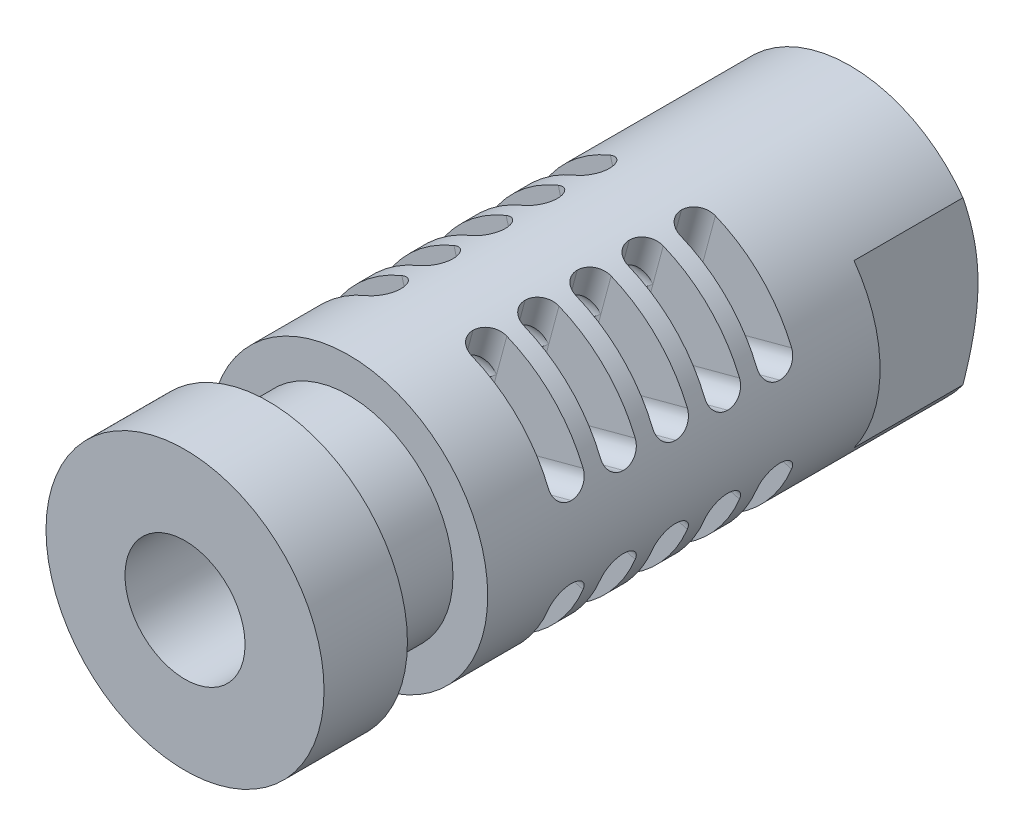
from build123d import *

# Parameters (mm, degrees)
SKETCH1_R                    = 8
BOSS_EXTRUDE1_DEPTH          = 20
CUT_EXTRUDE1_START           = -4.8
SKETCH2_OUTSIDE_W            = 27.192
SKETCH2_OUTSIDE_H            = 27.192
SKETCH2_OUTSIDE_R            = 6
CUT_EXTRUDE1_DEPTH           = 4.62
CHAMFER1_SIZE                = 3
CHAMFER1_SIZE2               = 1.732050808
SKETCH3_R                    = 3.275
CUT_EXTRUDE2_DEPTH           = 42.569219382
F_5_16_24_TAPPED_HOLE1_D     = 6.9088
F_5_16_24_TAPPED_HOLE1_DEPTH = 7.5
F_5_16_24_TAPPED_HOLE1_TIP   = 2.075612922
SKETCH6_R                    = 4
CUT_EXTRUDE3_DEPTH           = 3.2
F_5_16_24_TAPPED_HOLE2_D     = 6.9088
F_5_16_24_TAPPED_HOLE2_DEPTH = 11.5
F_5_16_24_TAPPED_HOLE2_TIP   = 2.075612922
SKETCH9_W                    = 4.482518631
SKETCH9_H                    = 17.886973385
CUT_EXTRUDE4_DEPTH           = 8
SKETCH12_W                   = 3.8
SKETCH12_H                   = 2
FILLET1_R                    = 1
LPATTERN4_COUNT              = 5
LPATTERN4_PITCH              = 3
FILLET1_OF_LPATTERN4_R       = 1
SKETCH10_R                   = 1
CUT_EXTRUDE6_DEPTH           = 23.978250656
LPATTERN5_COUNT              = 4
LPATTERN5_PITCH              = 3
MIRROR5_COPY_1_SKETCH_R      = 1
MIRROR5_COPY_1_DEPTH         = 23.978250656
MIRROR5_COPY_2_SKETCH_R      = 1
MIRROR5_COPY_2_DEPTH         = 23.978250656
MIRROR5_COPY_3_SKETCH_R      = 1
MIRROR5_COPY_3_DEPTH         = 23.978250656


# Read off the part's stored shape, not the designer's step: Mirror3, Mirror4
with BuildPart() as part:
    # Sketch1 → Boss-Extrude1 (new, symmetric)
    with BuildSketch(Plane.XY):
        Circle(SKETCH1_R)
    extrude(amount=BOSS_EXTRUDE1_DEPTH, both=True)

    # Sketch2 outside → Cut-Extrude1 (cut)
    with BuildSketch(Plane.XY.offset(20).offset(CUT_EXTRUDE1_START)):
        Rectangle(SKETCH2_OUTSIDE_W, SKETCH2_OUTSIDE_H)
        Circle(SKETCH2_OUTSIDE_R, mode=Mode.SUBTRACT)
    extrude(amount=-CUT_EXTRUDE1_DEPTH, mode=Mode.SUBTRACT)

    # Chamfer1
    chamfer1_edges = [part.edges().sort_by_distance(p)[0] for p in [
        (-8, 0, -20),
    ]]
    chamfer1_side = [part.faces().sort_by_distance(p)[0] for p in [
        (0, 0, -20),
    ]]
    chamfer(chamfer1_edges, length=CHAMFER1_SIZE, length2=CHAMFER1_SIZE2, reference=chamfer1_side[0])

    # Sketch3 → Cut-Extrude2 (cut, through all)
    with BuildSketch(Plane.XY.offset(20)):
        Circle(SKETCH3_R)
    extrude(amount=-CUT_EXTRUDE2_DEPTH, mode=Mode.SUBTRACT)

    # 5/16-24 Tapped Hole1
    with Locations(Plane.XY.offset(20)):
        with Locations((0, 0)):
            Hole(F_5_16_24_TAPPED_HOLE1_D / 2, depth=F_5_16_24_TAPPED_HOLE1_DEPTH)
            with Locations((0, 0, -(F_5_16_24_TAPPED_HOLE1_DEPTH + F_5_16_24_TAPPED_HOLE1_TIP / 2))):  # 118° drill point
                Cone(0, F_5_16_24_TAPPED_HOLE1_D / 2, F_5_16_24_TAPPED_HOLE1_TIP, mode=Mode.SUBTRACT)

    # Sketch6 → Cut-Extrude3 (cut)
    with BuildSketch(Plane(origin=(0, 0, -20), x_dir=(-1, 0, 0), z_dir=(0, 0, -1))):
        Circle(SKETCH6_R)
    extrude(amount=-CUT_EXTRUDE3_DEPTH, mode=Mode.SUBTRACT)

    # 5/16-24 Tapped Hole2
    with Locations(Plane(origin=(0, 0, -20), x_dir=(-1, 0, 0), z_dir=(0, 0, -1))):
        with Locations((0, 0)):
            Hole(F_5_16_24_TAPPED_HOLE2_D / 2, depth=F_5_16_24_TAPPED_HOLE2_DEPTH)
            with Locations((0, 0, -(F_5_16_24_TAPPED_HOLE2_DEPTH + F_5_16_24_TAPPED_HOLE2_TIP / 2))):  # 118° drill point
                Cone(0, F_5_16_24_TAPPED_HOLE2_D / 2, F_5_16_24_TAPPED_HOLE2_TIP, mode=Mode.SUBTRACT)

    # Sketch9 → Cut-Extrude4 (cut)
    with BuildSketch(Plane(origin=(0, 0, -20), x_dir=(-1, 0, 0), z_dir=(0, 0, -1))):
        with Locations((-8.741259316, 0.215505703)):
            Rectangle(SKETCH9_W, SKETCH9_H)
    cut_extrude4 = extrude(amount=-CUT_EXTRUDE4_DEPTH, mode=Mode.SUBTRACT)

    # Mirror1: Cut-Extrude4 across plane
    add(cut_extrude4.mirror(Plane(origin=(0, 0, 0), x_dir=(0, 0, 1), z_dir=(1, 0, 0))), mode=Mode.SUBTRACT)

    # Cut-Sweep1: sweep along a path in Sketch11
    with BuildLine(Plane(origin=(0, 0, -6.5), x_dir=(-1, 0, 0), z_dir=(0, 0, -1))) as cut_sweep1_path:
        ThreePointArc((-2.070552361, 7.72740661), (-5.656854249, 5.656854249), (-7.72740661, 2.070552361))
    # Sketch12 → Cut-Sweep1 (sweep, cut)
    with BuildSketch(Plane(origin=(7.72740661, 2.070552361, -6.5), x_dir=(-0.9659258262890688, -0.2588190451025193, 0), z_dir=(0.2588190451025193, -0.9659258262890688, 0))):
        with Locations((1.9, 0)):
            Rectangle(SKETCH12_W, SKETCH12_H)
    cut_sweep1 = sweep(path=cut_sweep1_path.line, mode=Mode.SUBTRACT)

    # Fillet1
    fillet1_edges = [part.edges().sort_by_distance(p)[0] for p in [
        (1.578796175, 5.89214754, -7.5),
        (1.578796175, 5.89214754, -5.5),
        (5.89214754, 1.578796175, -7.5),
        (5.89214754, 1.578796175, -5.5),
    ]]
    fillet(fillet1_edges, radius=FILLET1_R - 0.0001)  # a hair under: the kernel refuses the full size

    # LPattern4: Cut-Sweep1 ×5
    with Locations(*[(0, 0, i * LPATTERN4_PITCH) for i in range(1, LPATTERN4_COUNT)]):
        add(cut_sweep1, mode=Mode.SUBTRACT)

    # Fillet1 of LPattern4
    fillet1_of_lpattern4_edges = [part.edges().sort_by_distance(p)[0] for p in [
        (1.578796175, 5.89214754, -4.5),
        (1.578796175, 5.89214754, -2.5),
        (5.89214754, 1.578796175, -4.5),
        (5.89214754, 1.578796175, -2.5),
        (1.578796175, 5.89214754, -1.5),
        (1.578796175, 5.89214754, 0.5),
        (5.89214754, 1.578796175, -1.5),
        (5.89214754, 1.578796175, 0.5),
        (1.578796175, 5.89214754, 1.5),
        (1.578796175, 5.89214754, 3.5),
        (5.89214754, 1.578796175, 1.5),
        (5.89214754, 1.578796175, 3.5),
        (1.578796175, 5.89214754, 4.5),
        (1.578796175, 5.89214754, 6.5),
        (5.89214754, 1.578796175, 4.5),
        (5.89214754, 1.578796175, 6.5),
    ]]
    fillet(fillet1_of_lpattern4_edges, radius=FILLET1_OF_LPATTERN4_R - 0.0001)  # a hair under: the kernel refuses the full size

    # Mirror3
    split(bisect_by=Plane(origin=(0, 0, 0), x_dir=(0, 0, 1), z_dir=(1, 0, 0)), keep=Keep.TOP)

    # Mirror3 2: part across plane


with BuildPart() as part_1:
    add(part.part)
    add(part.part.mirror(Plane(origin=(0, 0, 0), x_dir=(0, 0, 1), z_dir=(1, 0, 0))))

    # Mirror4
    split(bisect_by=Plane.ZX, keep=Keep.TOP)

    # Mirror4 2: part across plane


with BuildPart() as part_2:
    add(part_1.part)
    add(part_1.part.mirror(Plane.ZX))

    # Sketch10 → Cut-Extrude6 (cut, symmetric)
    with BuildSketch(Plane(origin=(0, 0, 0), x_dir=(0, 0, -1), z_dir=(1, 0, 0))):
        with Locations((3.5, 5.2)):
            Circle(SKETCH10_R)
    cut_extrude6 = extrude(amount=CUT_EXTRUDE6_DEPTH, both=True, mode=Mode.SUBTRACT)

    # LPattern5: Cut-Extrude6 ×4
    with Locations(*[(0, 0, i * LPATTERN5_PITCH) for i in range(1, LPATTERN5_COUNT)]):
        add(cut_extrude6, mode=Mode.SUBTRACT)

    # Mirror5: Cut-Extrude6 across plane
    add(cut_extrude6.mirror(Plane.ZX), mode=Mode.SUBTRACT)

    # Mirror5 copy 1 sketch → Mirror5 copy 1 (cut, symmetric)
    with BuildSketch(Plane(origin=(0, 0, 3), x_dir=(0, 0, -1), z_dir=(1, 0, 0))):
        with Locations((3.5, -5.2)):
            Circle(MIRROR5_COPY_1_SKETCH_R)
    extrude(amount=MIRROR5_COPY_1_DEPTH, both=True, mode=Mode.SUBTRACT)

    # Mirror5 copy 2 sketch → Mirror5 copy 2 (cut, symmetric)
    with BuildSketch(Plane(origin=(0, 0, 6), x_dir=(0, 0, -1), z_dir=(1, 0, 0))):
        with Locations((3.5, -5.2)):
            Circle(MIRROR5_COPY_2_SKETCH_R)
    extrude(amount=MIRROR5_COPY_2_DEPTH, both=True, mode=Mode.SUBTRACT)

    # Mirror5 copy 3 sketch → Mirror5 copy 3 (cut, symmetric)
    with BuildSketch(Plane(origin=(0, 0, 9), x_dir=(0, 0, -1), z_dir=(1, 0, 0))):
        with Locations((3.5, -5.2)):
            Circle(MIRROR5_COPY_3_SKETCH_R)
    extrude(amount=MIRROR5_COPY_3_DEPTH, both=True, mode=Mode.SUBTRACT)


solid = part_2.part
